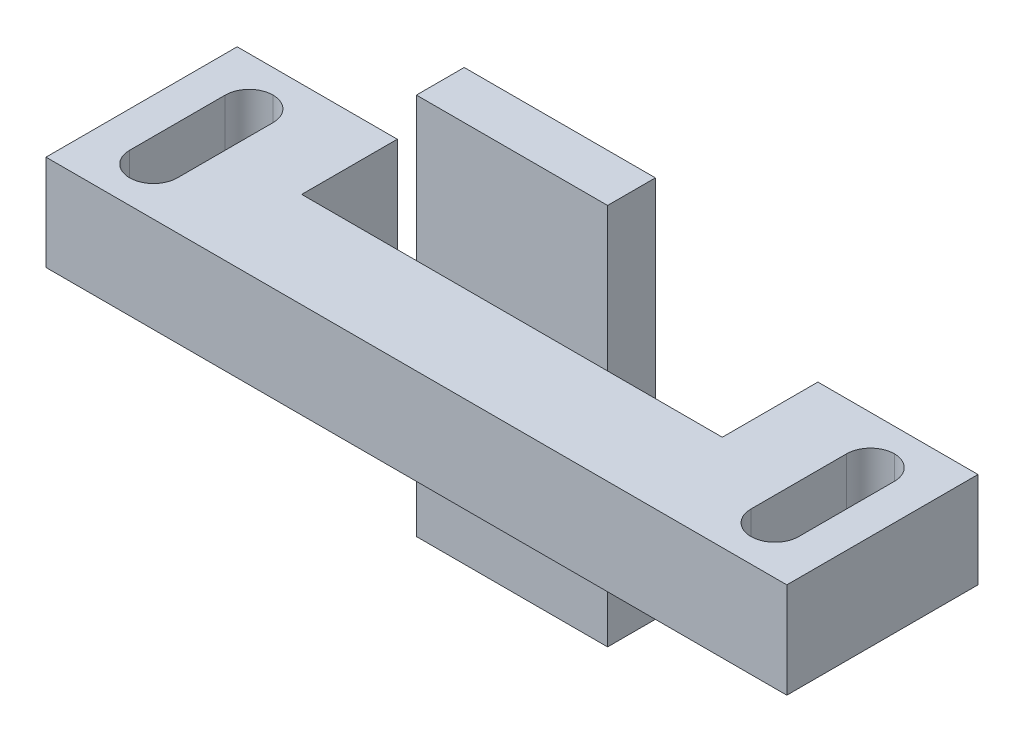
from build123d import *

# Parameters (mm, degrees)
SKETCH1_W            = 98.425
SKETCH1_H            = 12.7
BOSS_EXTRUDE1_DEPTH  = 12.7
CUT_EXTRUDE1_REACH   = 54.388
SKETCH2_W            = 6.35
SKETCH2_H            = 19.05
FILLET1_R            = 3.175
FILLET2_R            = 3.175
FILLET3_R            = 3.175
FILLET4_R            = 3.175
FILLET1_OF_MIRROR1_R = 3.175
FILLET2_OF_MIRROR1_R = 3.175
FILLET3_OF_MIRROR1_R = 3.175
FILLET4_OF_MIRROR1_R = 3.175
CUT_EXTRUDE2_REACH   = 54.388
SKETCH5_W            = 55.88
SKETCH5_H            = 12.7
SKETCH6_W            = 25.4
SKETCH6_H            = 50.8
BOSS_EXTRUDE3_DEPTH  = 6.35


with BuildPart() as part:
    # Sketch1 → Boss-Extrude1 (new, symmetric)
    with BuildSketch(Plane.XY):
        Rectangle(SKETCH1_W, SKETCH1_H)
    extrude(amount=BOSS_EXTRUDE1_DEPTH, both=True)

    # Sketch2 → Cut-Extrude1 (cut, up to next)
    with BuildSketch(Plane(origin=(0, 6.35, 0), x_dir=(1, 0, 0), z_dir=(0, 1, 0)), mode=Mode.PRIVATE) as cut_extrude1_sk1:
        with Locations((-41.275, 0)):
            Rectangle(SKETCH2_W, SKETCH2_H)
    cut_extrude1_tool1 = extrude(cut_extrude1_sk1.sketch, amount=-CUT_EXTRUDE1_REACH, mode=Mode.PRIVATE) & part.part
    cut_extrude1 = cut_extrude1_tool1.solids().sort_by_distance((-41.275, 6.35, 0))[0]
    add(cut_extrude1, mode=Mode.SUBTRACT)

    # Fillet1
    fillet1_edges = [part.edges().sort_by_distance(p)[0] for p in [
        (-44.45, 0, -9.525),
    ]]
    fillet(fillet1_edges, radius=FILLET1_R)

    # Fillet2
    fillet2_edges = [part.edges().sort_by_distance(p)[0] for p in [
        (-38.1, 0, -9.525),
    ]]
    fillet(fillet2_edges, radius=FILLET2_R - 0.0001)  # a hair under: the kernel refuses the full size

    # Fillet3
    fillet3_edges = [part.edges().sort_by_distance(p)[0] for p in [
        (-44.45, 0, 9.525),
    ]]
    fillet(fillet3_edges, radius=FILLET3_R)

    # Fillet4
    fillet4_edges = [part.edges().sort_by_distance(p)[0] for p in [
        (-38.1, 0, 9.525),
    ]]
    fillet(fillet4_edges, radius=FILLET4_R - 0.0001)  # a hair under: the kernel refuses the full size

    # Mirror1: Cut-Extrude1 across plane
    add(cut_extrude1.mirror(Plane(origin=(0, 0, 0), x_dir=(0, 0, 1), z_dir=(1, 0, 0))), mode=Mode.SUBTRACT)

    # Fillet1 of Mirror1
    fillet1_of_mirror1_edges = [part.edges().sort_by_distance(p)[0] for p in [
        (44.45, 0, -9.525),
    ]]
    fillet(fillet1_of_mirror1_edges, radius=FILLET1_OF_MIRROR1_R)

    # Fillet2 of Mirror1
    fillet2_of_mirror1_edges = [part.edges().sort_by_distance(p)[0] for p in [
        (38.1, 0, -9.525),
    ]]
    fillet(fillet2_of_mirror1_edges, radius=FILLET2_OF_MIRROR1_R - 0.0001)  # a hair under: the kernel refuses the full size

    # Fillet3 of Mirror1
    fillet3_of_mirror1_edges = [part.edges().sort_by_distance(p)[0] for p in [
        (44.45, 0, 9.525),
    ]]
    fillet(fillet3_of_mirror1_edges, radius=FILLET3_OF_MIRROR1_R)

    # Fillet4 of Mirror1
    fillet4_of_mirror1_edges = [part.edges().sort_by_distance(p)[0] for p in [
        (38.1, 0, 9.525),
    ]]
    fillet(fillet4_of_mirror1_edges, radius=FILLET4_OF_MIRROR1_R - 0.0001)  # a hair under: the kernel refuses the full size

    # Sketch5 → Cut-Extrude2 (cut, up to next)
    with BuildSketch(Plane(origin=(0, 6.35, 0), x_dir=(1, 0, 0), z_dir=(0, 1, 0)), mode=Mode.PRIVATE) as cut_extrude2_sk1:
        with Locations((0, 6.35)):
            Rectangle(SKETCH5_W, SKETCH5_H)
    cut_extrude2_tool1 = extrude(cut_extrude2_sk1.sketch, amount=-CUT_EXTRUDE2_REACH, mode=Mode.PRIVATE) & part.part
    add(cut_extrude2_tool1.solids().sort_by_distance((0, 6.35, -6.35))[0], mode=Mode.SUBTRACT)

    # Sketch6 → Boss-Extrude3 (add)
    with BuildSketch(Plane(origin=(0, 0, 0), x_dir=(-1, 0, 0), z_dir=(0, 0, -1))):
        Rectangle(SKETCH6_W, SKETCH6_H)
    extrude(amount=BOSS_EXTRUDE3_DEPTH)


solid = part.part
